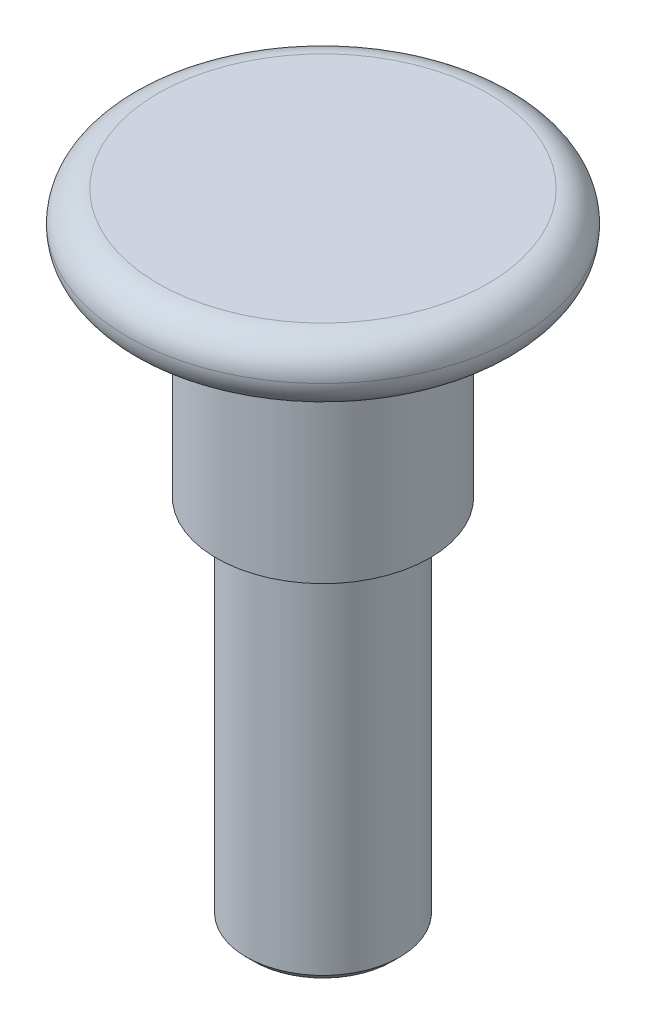
from build123d import *

# Parameters (mm, degrees)
FILETE1_R     = 2
CHANFRO1_SIZE = 0.5


with BuildPart() as part:
    # Esboço1 → Revolução1 (revolve)
    with BuildSketch(Plane.XY):
        Polygon((0, 61.836212625), (12.75, 61.836212625), (12.75, 57.836212625), (6.95, 57.836212625), (6.95, 44.436212625), (5, 44.436212625), (5, 20.436212625), (2, 20.436212625), (2, 29.436212625), (0, 30.686212625), align=None)
    revolve(axis=Axis((0, -52.719767442, 0), (0, 1, 0)))

    # Filete1
    filete1_edges = [part.edges().sort_by_distance(p)[0] for p in [
        (-12.75, 57.836212625, 0),
        (-12.75, 61.836212625, 0),
    ]]
    fillet(filete1_edges, radius=FILETE1_R - 0.0001)  # a hair under: the kernel refuses the full size

    # Chanfro1
    chanfro1_edges = [part.edges().sort_by_distance(p)[0] for p in [
        (-5, 20.436212625, 0),
    ]]
    chamfer(chanfro1_edges, length=CHANFRO1_SIZE)


solid = part.part
